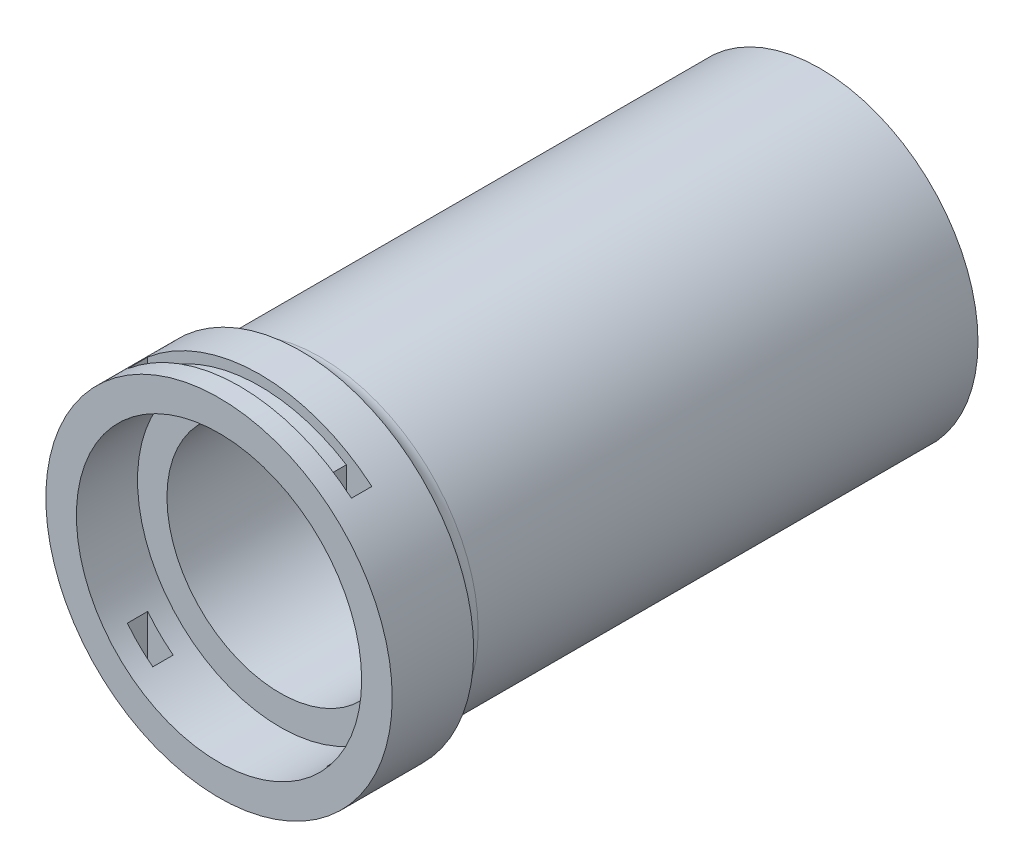
from build123d import *

# Parameters (mm, degrees)
SKETCH1_R                = 15.5
BOSS_EXTRUDE5_DEPTH      = 26
SKETCH3_R                = 5.625
CUT_EXTRUDE2_DEPTH       = 35.007352146
CUT_EXTRUDE3_DEPTH       = 28
CUT_EXTRUDE3_DEPTH_BACK  = 20
SKETCH4_R                = 11.1125
CUT_EXTRUDE6_START       = 6
SKETCH7_R                = 11
SKETCH7_R_2              = 9
CUT_EXTRUDE6_DEPTH       = 2
BOSS_EXTRUDE8_DEPTH      = 6
BOSS_EXTRUDE8_DEPTH_BACK = 2
BOSS_EXTRUDE8_START      = 20
SKETCH12_R               = 17
CUT_EXTRUDE10_START      = 18
SKETCH13_R               = 11
CUT_EXTRUDE10_DEPTH      = 18.411862419
FILLET2_R                = 2
CUT_EXTRUDE11_START      = 26
SKETCH14_R               = 14
CUT_EXTRUDE11_DEPTH      = 6
SKETCH15_R               = 0.5
CUT_EXTRUDE14_DEPTH      = 36.411862419
SKETCH18_W               = 2.5
SKETCH18_H               = 2
CUT_EXTRUDE15_DEPTH      = 20
CUT_EXTRUDE16_DEPTH      = 2
BOSS_EXTRUDE9_START      = 33
SKETCH26_R               = 15.5
SKETCH26_R_2             = 5.625
SKETCH26_R_3             = 0.5
BOSS_EXTRUDE9_DEPTH      = 33
SKETCH27_R               = 11.1125
CUT_EXTRUDE17_DEPTH      = 33
BOSS_EXTRUDE10_START     = -35
SKETCH24_R               = 9
SKETCH24_R_2             = 5.625
BOSS_EXTRUDE10_DEPTH     = 35


with BuildPart() as part:
    # Sketch1 → Boss-Extrude5 (new body)
    with BuildSketch(Plane.XY):
        Circle(SKETCH1_R)
    extrude(amount=BOSS_EXTRUDE5_DEPTH)

    # Sketch3 → Cut-Extrude2 (cut, through all)
    with BuildSketch(Plane.XY.offset(26)):
        Circle(SKETCH3_R)
    extrude(amount=-CUT_EXTRUDE2_DEPTH, mode=Mode.SUBTRACT)

    # Sketch4 → Cut-Extrude3 (cut, two sides: drawn at the far end of the back side and taken through both)
    with BuildSketch(Plane.XY.offset(26).offset(-CUT_EXTRUDE3_DEPTH_BACK)):
        Circle(SKETCH4_R)
    extrude(amount=CUT_EXTRUDE3_DEPTH + CUT_EXTRUDE3_DEPTH_BACK, mode=Mode.SUBTRACT)

    # Sketch7 → Cut-Extrude6 (cut)
    with BuildSketch(Plane.XY.offset(CUT_EXTRUDE6_START)):
        Circle(SKETCH7_R)
        Circle(SKETCH7_R_2, mode=Mode.SUBTRACT)
    extrude(amount=-CUT_EXTRUDE6_DEPTH, mode=Mode.SUBTRACT)

    # Sketch12 → Boss-Extrude8 (add, two sides: drawn at the far end of the back side and taken through both)
    with BuildSketch(Plane.XY.offset(BOSS_EXTRUDE8_START - BOSS_EXTRUDE8_DEPTH_BACK)):
        Circle(SKETCH12_R)
    extrude(amount=BOSS_EXTRUDE8_DEPTH + BOSS_EXTRUDE8_DEPTH_BACK)

    # Sketch13 → Cut-Extrude10 (cut, through all)
    with BuildSketch(Plane.XY.offset(CUT_EXTRUDE10_START)):
        Circle(SKETCH13_R)
    extrude(amount=CUT_EXTRUDE10_DEPTH, mode=Mode.SUBTRACT)

    # Fillet2
    # the kernel refuses this fillet: 2 mm, written as the material it adds along each edge
    with BuildSketch(Plane(origin=(0, 0, 18), x_dir=(1, 0, 0), z_dir=(0, 1, 0))) as fillet2_piece_1:
        with BuildLine():
            CenterArc((17.5, 1.936491673), FILLET2_R, 180, 75.522487814)
            Line((17, 0), (16.99, -0.038729833))
            ThreePointArc((16.99, -0.038729833), (16.25, -0.04), (15.5, -0.04))
            Line((15.5, -0.04), (15.46, 0))
            Line((15.46, 0), (15.46, 1.936491673))
            Line((15.46, 1.936491673), (15.5, 1.936491673))
        make_face()
    revolve(axis=Axis((0, 0, 18), (0, 0, -1)))

    # Sketch14 → Cut-Extrude11 (cut)
    with BuildSketch(Plane.XY.offset(CUT_EXTRUDE11_START)):
        Circle(SKETCH14_R)
    extrude(amount=-CUT_EXTRUDE11_DEPTH, mode=Mode.SUBTRACT)

    # Sketch15 → Cut-Extrude14 (cut, through all)
    with BuildSketch(Plane.XY):
        with Locations((0, 10)):
            Circle(SKETCH15_R)
        with Locations((0, -10)):
            Circle(SKETCH15_R)
        with Locations((10, 0)):
            Circle(SKETCH15_R)
        with Locations((-10, 0)):
            Circle(SKETCH15_R)
    extrude(amount=CUT_EXTRUDE14_DEPTH, mode=Mode.SUBTRACT)

    # Sketch18 → Cut-Extrude15 (cut, symmetric)
    with BuildSketch(Plane(origin=(0, 0, 0), x_dir=(1, 0, 0), z_dir=(0, 1, 0))):
        with Locations((-9.75, -23)):
            Rectangle(SKETCH18_W, SKETCH18_H)
        with Locations((9.75, -23)):
            Rectangle(SKETCH18_W, SKETCH18_H)
    extrude(amount=CUT_EXTRUDE15_DEPTH, both=True, mode=Mode.SUBTRACT)

    # Sketch23 → Cut-Extrude16 (cut)
    with BuildSketch(Plane(origin=(0, 0, 24), x_dir=(-1, 0, 0), z_dir=(0, 0, -1))):
        with BuildLine():
            Line((9.719197711, 13.947659153), (9.147480199, 13.127208615))
            ThreePointArc((9.147480199, 13.127208615), (0, 16), (-9.147480199, 13.127208615))
            Line((-9.147480199, 13.127208615), (-9.719197711, 13.947659153))
            ThreePointArc((-9.719197711, 13.947659153), (0, 17), (9.719197711, 13.947659153))
        make_face()
        with BuildLine():
            Line((-9.147480199, -13.127208615), (-9.719197711, -13.947659153))
            ThreePointArc((-9.719197711, -13.947659153), (0, -17), (9.719197711, -13.947659153))
            Line((9.719197711, -13.947659153), (9.147480199, -13.127208615))
            ThreePointArc((9.147480199, -13.127208615), (0, -16), (-9.147480199, -13.127208615))
        make_face()
    extrude(amount=CUT_EXTRUDE16_DEPTH, mode=Mode.SUBTRACT)

    # Sketch26 → Boss-Extrude9 (add)
    with BuildSketch(Plane(origin=(0, 0, 0), x_dir=(-1, 0, 0), z_dir=(0, 0, -1)).offset(BOSS_EXTRUDE9_START)):
        Circle(SKETCH26_R)
        with Locations(Location((0, 0, 0), (0, 0, 180))):
            Circle(SKETCH26_R_2, mode=Mode.SUBTRACT)
        with Locations((-10, 0)):
            Circle(SKETCH26_R_3, mode=Mode.SUBTRACT)
        with Locations((0, 10)):
            Circle(SKETCH26_R_3, mode=Mode.SUBTRACT)
        with Locations((10, 0)):
            Circle(SKETCH26_R_3, mode=Mode.SUBTRACT)
        with Locations((0, -10)):
            Circle(SKETCH26_R_3, mode=Mode.SUBTRACT)
    extrude(amount=-BOSS_EXTRUDE9_DEPTH)

    # Sketch27 → Cut-Extrude17 (cut, symmetric)
    with BuildSketch(Plane.XY.offset(4)):
        Circle(SKETCH27_R)
    extrude(amount=CUT_EXTRUDE17_DEPTH, both=True, mode=Mode.SUBTRACT)

    # Sketch24 → Boss-Extrude10 (add)
    with BuildSketch(Plane.XY.offset(6).offset(BOSS_EXTRUDE10_START)):
        Circle(SKETCH24_R)
        Circle(SKETCH24_R_2, mode=Mode.SUBTRACT)
    extrude(amount=BOSS_EXTRUDE10_DEPTH)


solid = part.part
